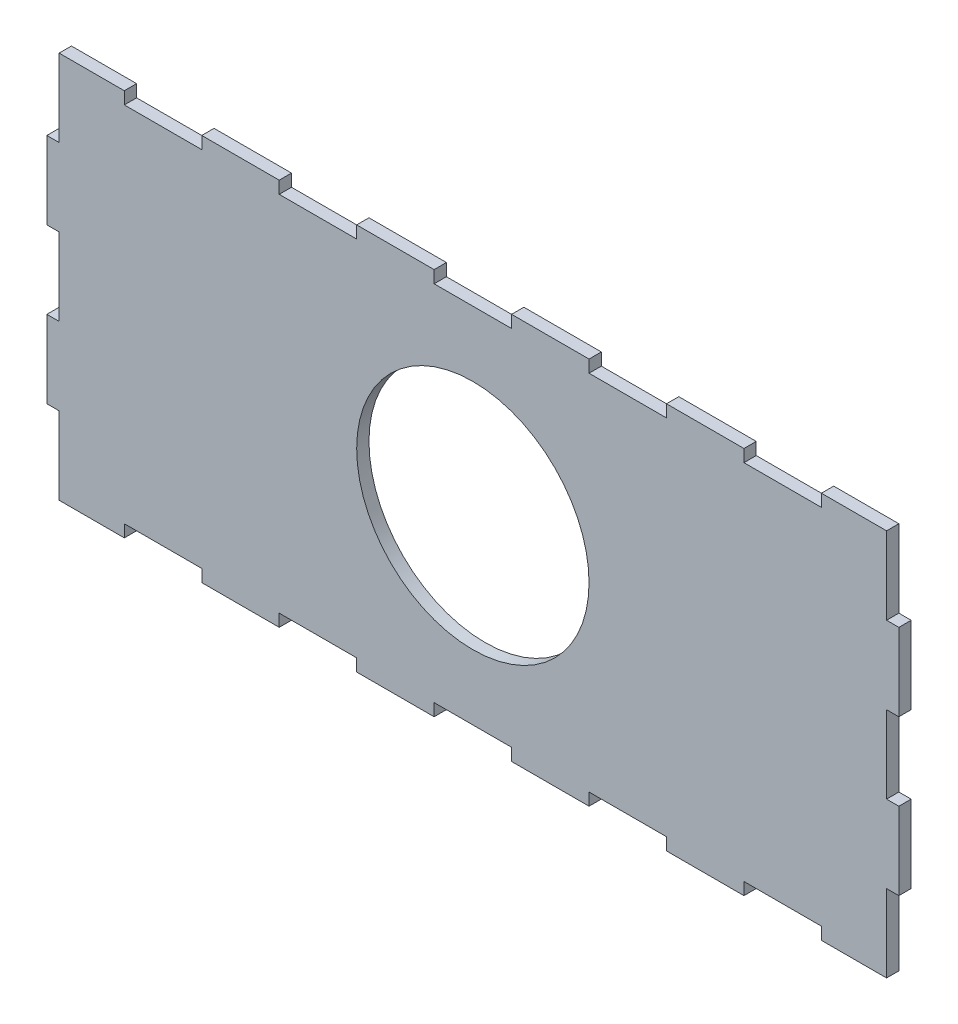
from build123d import *
from OCP.BRepAlgoAPI import BRepAlgoAPI_Cut
from OCP.TopTools import TopTools_ListOfShape

# Parameters (mm, degrees)
SKETCH1_W           = 2200
SKETCH1_H           = 1000
BOSS_EXTRUDE1_DEPTH = 750
SHELL1_T            = -31.75
SCALE1_SCALE        = 0.1
SKETCH36_W          = 3.1749958
SKETCH36_H          = 20.000053956
SKETCH36_W_2        = 3.175
SKETCH36_H_2        = 20
SKETCH36_W_3        = 20
SKETCH36_H_3        = 3.17496467
SKETCH36_H_4        = 3.17503533
CUT_EXTRUDE18_DEPTH = 3.175
SKETCH37_R          = 30
CUT_EXTRUDE19_DEPTH = 3.175
SKETCH38_W          = 3.331279269
SKETCH38_H          = 0.686362951
CUT_EXTRUDE20_DEPTH = 3.175


with BuildPart() as part:
    # Sketch1 → Boss-Extrude1 (new body)
    with BuildSketch(Plane.XY):
        Rectangle(SKETCH1_W, SKETCH1_H)
    extrude(amount=BOSS_EXTRUDE1_DEPTH)

    # Shell1
    shell1_openings = [part.faces().sort_by_distance(p)[0] for p in [
        (0, -500, 375),
        (-1100, 0, 375),
        (0, 500, 375),
        (1100, 0, 375),
        (0, 0, 0),
    ]]
    offset(amount=SHELL1_T, openings=shell1_openings, kind=Kind.INTERSECTION)


with BuildPart() as part_1:
    # Scale1: scaled about (0, 0, 734.125)
    add(part.part.scale(SCALE1_SCALE).moved(Location((0, 0, 660.7125))))


with BuildPart() as cut_extrude18_tool:
    # Sketch36 → Cut-Extrude18 (new body)
    with BuildSketch(Plane.XY.offset(735.7125)):
        with Locations((-108.4125021, 2.6978e-05)):
            Rectangle(SKETCH36_W, SKETCH36_H)
        with Locations((108.4124958, -39.999946044)):
            Rectangle(SKETCH36_W_2, SKETCH36_H_2)
        with Locations((108.4124958, 5.3956e-05)):
            Rectangle(SKETCH36_W_2, SKETCH36_H_2)
        with Locations((108.4124958, 40.000053956)):
            Rectangle(SKETCH36_W_2, SKETCH36_H_2)
        with Locations((-108.4125021, -39.999973022)):
            Rectangle(SKETCH36_W, SKETCH36_H)
        with Locations((-108.4125021, 40.000026978)):
            Rectangle(SKETCH36_W, SKETCH36_H)
        with Locations((39.9999958, 48.412517665)):
            Rectangle(SKETCH36_W_3, SKETCH36_H_3)
        with Locations((79.9999958, 48.412517665)):
            Rectangle(SKETCH36_W_3, SKETCH36_H_3)
        with Locations((-4.2e-06, 48.412517665)):
            Rectangle(SKETCH36_W_3, SKETCH36_H_3)
        with Locations((-40.0000042, 48.412517665)):
            Rectangle(SKETCH36_W_3, SKETCH36_H_3)
        with Locations((-80.0000042, 48.412517665)):
            Rectangle(SKETCH36_W_3, SKETCH36_H_3)
        with Locations((39.9999958, -48.412482335)):
            Rectangle(SKETCH36_W_3, SKETCH36_H_4)
        with Locations((79.9999958, -48.412482335)):
            Rectangle(SKETCH36_W_3, SKETCH36_H_4)
        with Locations((-4.2e-06, -48.412482335)):
            Rectangle(SKETCH36_W_3, SKETCH36_H_4)
        with Locations((-40.0000042, -48.412482335)):
            Rectangle(SKETCH36_W_3, SKETCH36_H_4)
        with Locations((-80.0000042, -48.412482335)):
            Rectangle(SKETCH36_W_3, SKETCH36_H_4)
    extrude(amount=-CUT_EXTRUDE18_DEPTH)


with BuildPart() as part_2:
    add(part_1.part)

    # Cut-Extrude18: cut by cut_extrude18_tool, with a tolerance
    cut_extrude18_stock = TopTools_ListOfShape()
    cut_extrude18_stock.Append(part_2.part.wrapped)
    cut_extrude18_tools = TopTools_ListOfShape()
    cut_extrude18_tools.Append(cut_extrude18_tool.part.wrapped)
    cut_extrude18_cut = BRepAlgoAPI_Cut()
    cut_extrude18_cut.SetArguments(cut_extrude18_stock)
    cut_extrude18_cut.SetTools(cut_extrude18_tools)
    cut_extrude18_cut.SetFuzzyValue(0.00001)
    cut_extrude18_cut.Build()
    add(Compound.cast(cut_extrude18_cut.Shape()).solids(), mode=Mode.REPLACE)

    # Sketch37 → Cut-Extrude19 (cut)
    with BuildSketch(Plane.XY.offset(735.7125)):
        Circle(SKETCH37_R)
    extrude(amount=-CUT_EXTRUDE19_DEPTH, mode=Mode.SUBTRACT)

    # Sketch38 → Cut-Extrude20 (cut)
    with BuildSketch(Plane.XY.offset(735.7125)):
        with Locations((108.490635435, -49.938595097)):
            Rectangle(SKETCH38_W, SKETCH38_H)
    extrude(amount=-CUT_EXTRUDE20_DEPTH, mode=Mode.SUBTRACT)


solid = part_2.part
